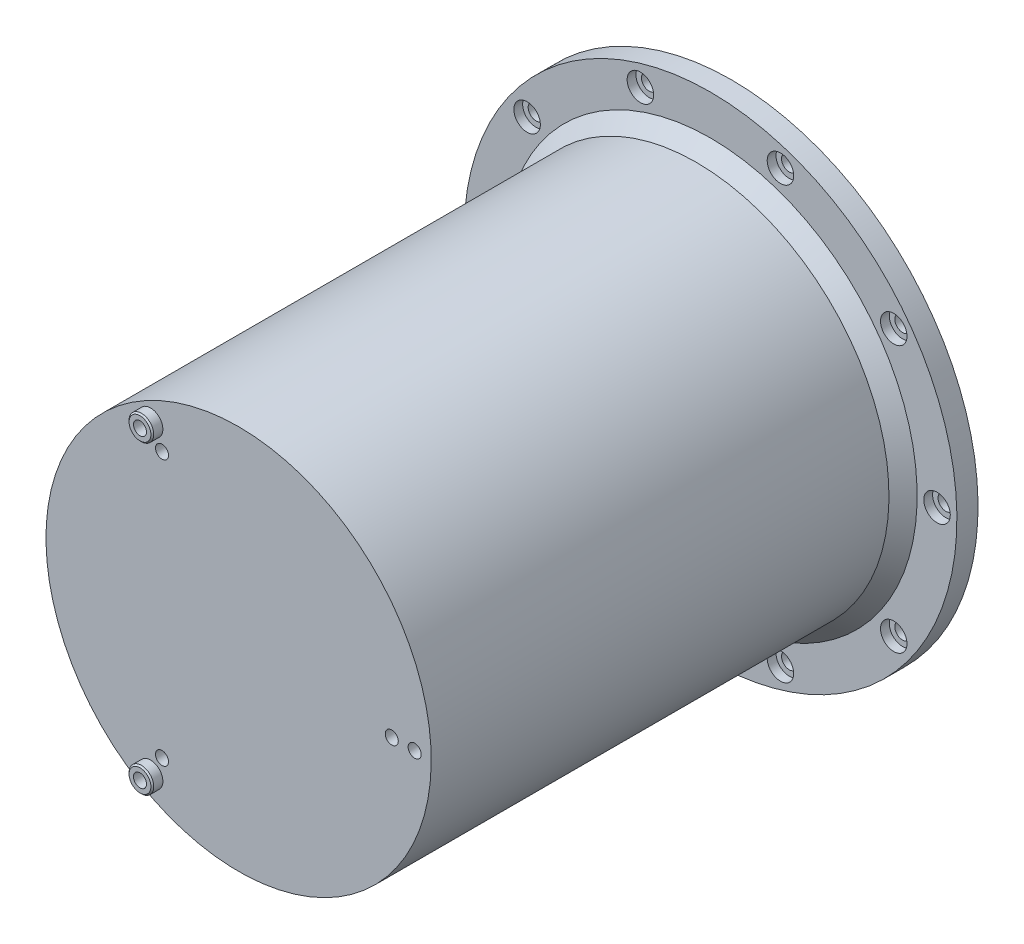
from build123d import *

# Parameters (mm, degrees)
SCHIZZO1_R                                           = 273.53258218
ESTRUSIONE_ESTRUSIONE1_DEPTH                         = 15
SCHIZZO5_R                                           = 273.53258218
ESTRUSIONE_ESTRUSIONE4_DEPTH                         = 685
SCHIZZO6_R                                           = 350
ESTRUSIONE_ESTRUSIONE5_DEPTH                         = 30
SMUSSO2_SIZE                                         = 20
FORO_LAMATO_PER_BULLONE_M20_A_TESTA_ESAG_D           = 22
FORO_LAMATO_PER_BULLONE_M20_A_TESTA_ESAG_CBORE_D     = 37.641
FORO_LAMATO_PER_BULLONE_M20_A_TESTA_ESAG_CBORE_DEPTH = 12.5
RIPETIZIONECIRCOLARE1_COUNT                          = 10
ESTRUSIONE_ESTRUSIONE6_START                         = 15
SCHIZZO10_R                                          = 9.25
ESTRUSIONE_ESTRUSIONE6_DEPTH                         = 15


with BuildPart() as part:
    # Schizzo1 → Estrusione-Estrusione1 (new body)
    with BuildSketch(Plane(origin=(0, 0, -132.207810149), x_dir=(-1, 0, 0), z_dir=(0, 0, -1))):
        with Locations(Location((214.171121607, -331.684921883, 0), (0, 0, 90))):
            Circle(SCHIZZO1_R)
        with BuildLine():
            ThreePointArc((-35.828878393, -322.434921883), (-45.078878393, -331.684921883), (-35.828878393, -340.934921883))
            ThreePointArc((-35.828878393, -340.934921883), (-26.578878393, -331.684921883), (-35.828878393, -322.434921883))
        make_face(mode=Mode.SUBTRACT)
        with BuildLine():
            ThreePointArc((-3.328878393, -340.934921883), (5.921121607, -331.684921883), (-3.328878393, -322.434921883))
            ThreePointArc((-3.328878393, -322.434921883), (-12.578878393, -331.684921883), (-3.328878393, -340.934921883))
        make_face(mode=Mode.SUBTRACT)
        with BuildLine():
            ThreePointArc((322.921121607, -134.074396559), (313.671121607, -143.324396559), (322.921121607, -152.574396559))
            ThreePointArc((322.921121607, -152.574396559), (332.171121607, -143.324396559), (322.921121607, -134.074396559))
        make_face(mode=Mode.SUBTRACT)
        with BuildLine():
            ThreePointArc((339.171121607, -124.428570936), (348.421121607, -115.178570936), (339.171121607, -105.928570936))
            ThreePointArc((339.171121607, -105.928570936), (329.921121607, -115.178570936), (339.171121607, -124.428570936))
        make_face(mode=Mode.SUBTRACT)
        with BuildLine():
            ThreePointArc((322.921121607, -529.295447206), (332.171121607, -520.045447206), (322.921121607, -510.795447206))
            ThreePointArc((322.921121607, -510.795447206), (313.671121607, -520.045447206), (322.921121607, -529.295447206))
        make_face(mode=Mode.SUBTRACT)
        with BuildLine():
            ThreePointArc((339.171121607, -557.441272829), (348.421121607, -548.191272829), (339.171121607, -538.941272829))
            ThreePointArc((339.171121607, -538.941272829), (329.921121607, -548.191272829), (339.171121607, -557.441272829))
        make_face(mode=Mode.SUBTRACT)
    extrude(amount=ESTRUSIONE_ESTRUSIONE1_DEPTH)

    # Schizzo5 → Estrusione-Estrusione4 (add)
    with BuildSketch(Plane(origin=(0, 0, -147.207810149), x_dir=(-1, 0, 0), z_dir=(0, 0, -1))):
        with Locations(Location((214.171121607, -331.684921883, 0), (0, 0, 90))):
            Circle(SCHIZZO5_R)
    extrude(amount=ESTRUSIONE_ESTRUSIONE4_DEPTH)

    # Schizzo6 → Estrusione-Estrusione5 (add)
    with BuildSketch(Plane(origin=(0, 0, -832.207810149), x_dir=(-1, 0, 0), z_dir=(0, 0, -1))):
        with Locations(Location((214.171121607, -331.684921883, 0), (0, 0, 90))):
            Circle(SCHIZZO6_R)
    extrude(amount=-ESTRUSIONE_ESTRUSIONE5_DEPTH)

    # Smusso2
    smusso2_edges = [part.edges().sort_by_distance(p)[0] for p in [
        (-214.171121607, -605.217504063, -802.207810149),
    ]]
    chamfer(smusso2_edges, length=SMUSSO2_SIZE)

    # Foro lamato per Bullone M20 a testa esagonale-1 (through all)
    with Locations(Plane(origin=(107.595169483, -331.684921883, -802.207810149), x_dir=(0, 1, 0), z_dir=(0, 0, 1))):
        with Locations((0, 0)):
            foro_lamato_per_bullone_m20_a_testa_esag = CounterBoreHole(FORO_LAMATO_PER_BULLONE_M20_A_TESTA_ESAG_D / 2, FORO_LAMATO_PER_BULLONE_M20_A_TESTA_ESAG_CBORE_D / 2, FORO_LAMATO_PER_BULLONE_M20_A_TESTA_ESAG_CBORE_DEPTH)

    # RipetizioneCircolare1: Foro lamato per Bullone M20 a testa esagonale-1 ×10 about axis
    ripetizionecircolare1_axis = Axis((-214.171121607, -331.684921883, 0), (0, 0, 1))
    for i in range(1, RIPETIZIONECIRCOLARE1_COUNT):
        add(foro_lamato_per_bullone_m20_a_testa_esag.rotate(ripetizionecircolare1_axis, i * 360 / RIPETIZIONECIRCOLARE1_COUNT), mode=Mode.SUBTRACT)

    # Schizzo10 → Estrusione-Estrusione6 (add)
    # profile 1 of 2: a face of its own
    with BuildSketch(Plane.XY.offset(-132.207810149).offset(ESTRUSIONE_ESTRUSIONE6_START)):
        with BuildLine():
            ThreePointArc((-339.171121607, -132.678570936), (-321.671121607, -115.178570936), (-339.171121607, -97.678570936))
            ThreePointArc((-339.171121607, -97.678570936), (-356.671121607, -115.178570936), (-339.171121607, -132.678570936))
        make_face()
        with Locations((-339.171121607, -115.178570936)):
            Circle(SCHIZZO10_R, mode=Mode.SUBTRACT)
    # profile 2 of 2: a face of its own
    with BuildSketch(Plane.XY.offset(-132.207810149).offset(ESTRUSIONE_ESTRUSIONE6_START)):
        with BuildLine():
            ThreePointArc((-339.171121607, -565.691272829), (-321.671121607, -548.191272829), (-339.171121607, -530.691272829))
            ThreePointArc((-339.171121607, -530.691272829), (-356.671121607, -548.191272829), (-339.171121607, -565.691272829))
        make_face()
        with Locations((-339.171121607, -548.191272829)):
            Circle(SCHIZZO10_R, mode=Mode.SUBTRACT)
    extrude(amount=-ESTRUSIONE_ESTRUSIONE6_DEPTH)

    # Smusso3: read off the stored shape, not the designer's step
    # Smusso3 outline → Smusso3 (revolve, cut)
    with BuildSketch(Plane(origin=(-339.171121607, -115.178570936, 0), x_dir=(1, 0, 0), z_dir=(0, -1, 0))):
        Polygon((17.5, -117.207810149), (15.5, -117.207810149), (17.5, -119.207810149), align=None)
    revolve(axis=Axis((-339.171121607, -115.178570936, 0), (0, 0, 1)), mode=Mode.SUBTRACT)

    # Smusso3 2 outline → Smusso3 2 (revolve, cut)
    with BuildSketch(Plane(origin=(-339.171121607, -548.191272829, 0), x_dir=(1, 0, 0), z_dir=(0, -1, 0))):
        Polygon((17.5, -117.207810149), (15.5, -117.207810149), (17.5, -119.207810149), align=None)
    revolve(axis=Axis((-339.171121607, -548.191272829, 0), (0, 0, 1)), mode=Mode.SUBTRACT)


solid = part.part
